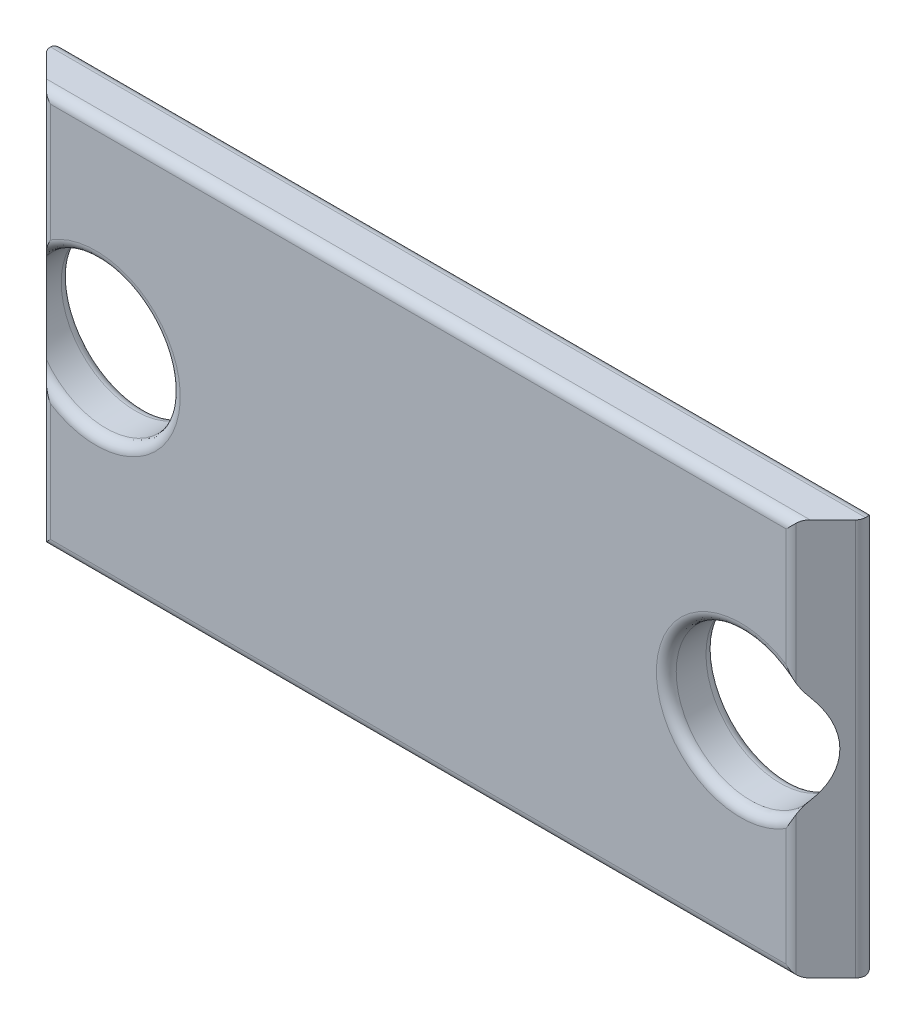
from build123d import *

# Parameters (mm, degrees)
ESQUISSE1_W        = 17
ESQUISSE1_H        = 8
ESQUISSE1_R        = 1.5
BOSS_EXTRU_1_DEPTH = 1
CHANFREIN1_SIZE    = 1
CONG_1_R           = 0.2


with BuildPart() as part:
    # Esquisse1 → Boss.-Extru.1 (new body)
    with BuildSketch(Plane.XY):
        with Locations((8.5, 4)):
            Rectangle(ESQUISSE1_W, ESQUISSE1_H)
        with Locations((2, 4)):
            Circle(ESQUISSE1_R, mode=Mode.SUBTRACT)
        with Locations((15, 4)):
            Circle(ESQUISSE1_R, mode=Mode.SUBTRACT)
    extrude(amount=BOSS_EXTRU_1_DEPTH)

    # Chanfrein1
    # the kernel refuses this chamfer: 1 mm, written as the material it takes off along each edge
    with BuildSketch(Plane(origin=(17, -2.571682988, 1), x_dir=(0.02749587661058563, 0, -0.9996219169112968), z_dir=(0, 1, 0)), Plane(origin=(0, 10.571682988, 1), x_dir=(-0.027495876610586372, 0, -0.9996219169112968), z_dir=(0, -1, 0))) as chanfrein1_piece_1:
        Polygon((CHANFREIN1_SIZE * 0.999621916911, CHANFREIN1_SIZE * 0.0274958766106), (-CHANFREIN1_SIZE * 0.0274958766106, CHANFREIN1_SIZE * 0.999621916911), (0, 0), align=None)
    extrude(amount=13.143365976, mode=Mode.SUBTRACT)

    # Congé1
    # the kernel refuses this fillet: 0.2 mm, written as the material it takes off along each edge
    with BuildSketch(Plane(origin=(15, 4, 0), x_dir=(1, 0, 0), z_dir=(0, -1, 0))) as cong_1_piece_1:
        with BuildLine():
            CenterArc((1.5 + CONG_1_R, CONG_1_R), CONG_1_R, 180, 90)
            Line((1.5, CONG_1_R), (1.5, 0))
            Line((1.5, 0), (1.5 + CONG_1_R, 0))
        make_face()
    revolve(axis=Axis((15, 4, 0), (0, 0, 1)), mode=Mode.SUBTRACT)
    with BuildSketch(Plane(origin=(-0.5, 0, 0), x_dir=(0, 0, 1), z_dir=(1, 0, 0))) as cong_1_piece_2:
        with BuildLine():
            CenterArc((CONG_1_R, -CONG_1_R), CONG_1_R, 90, 90)
            Line((0, -CONG_1_R), (0, 0))
            Line((0, 0), (CONG_1_R, 0))
        make_face()
    extrude(amount=18, mode=Mode.SUBTRACT)
    with BuildSketch(Plane(origin=(17, -1.207106781, 0), x_dir=(-1, 0, 0), z_dir=(0, 1, 0)), Plane(origin=(0, 9.207106781, 0), x_dir=(1, 0, 0), z_dir=(0, -1, 0))) as cong_1_piece_3:
        with BuildLine():
            CenterArc((CONG_1_R * 2.41421356237, CONG_1_R), CONG_1_R, 135, 135)
            Line((CONG_1_R * 1.70710678119, CONG_1_R * 1.70710678119), (0, 0))
            Line((0, 0), (CONG_1_R * 2.41421356237, 0))
        make_face()
    extrude(amount=10.414213562, mode=Mode.SUBTRACT)
    with BuildSketch(Plane(origin=(17.5, 8, 0), x_dir=(0, -1, 0), z_dir=(-1, 0, 0))) as cong_1_piece_4:
        with BuildLine():
            CenterArc((CONG_1_R, CONG_1_R), CONG_1_R, 180, 90)
            Line((0, CONG_1_R), (0, 0))
            Line((0, 0), (CONG_1_R, 0))
        make_face()
    extrude(amount=18, mode=Mode.SUBTRACT)
    with BuildSketch(Plane(origin=(2, 4, 0), x_dir=(1, 0, 0), z_dir=(0, -1, 0))) as cong_1_piece_5:
        with BuildLine():
            CenterArc((1.5 + CONG_1_R, CONG_1_R), CONG_1_R, 180, 90)
            Line((1.5, CONG_1_R), (1.5, 0))
            Line((1.5, 0), (1.5 + CONG_1_R, 0))
        make_face()
    revolve(axis=Axis((2, 4, 0), (0, 0, 1)), mode=Mode.SUBTRACT)
    with BuildSketch(Plane(origin=(1, 3.089072792, 1), x_dir=(1, 0, 0), z_dir=(0, -1, 0)), Plane(origin=(1, 8.207106781, 1), x_dir=(1, 0, 0), z_dir=(0, -1, 0))) as cong_1_piece_6:
        with BuildLine():
            CenterArc((CONG_1_R * 0.414213562373, -CONG_1_R), CONG_1_R, 90, 45)
            Line((-CONG_1_R * 0.292893218813, -CONG_1_R * 0.292893218813), (0, 0))
            Line((0, 0), (CONG_1_R * 0.414213562373, 0))
        make_face()
    extrude(amount=3.296179574, mode=Mode.SUBTRACT)
    with BuildSketch(Plane(origin=(2, 4, 1), x_dir=(-0.8739874769428458, -0.4859484439187749, 0), z_dir=(-0.4859484439187749, 0.8739874769428458, 0))) as cong_1_piece_7:
        with BuildLine():
            CenterArc((1.5 + CONG_1_R, -CONG_1_R), CONG_1_R, 90, 90)
            Line((1.5, -CONG_1_R), (1.5, 0))
            Line((1.5, 0), (1.5 + CONG_1_R, 0))
        make_face()
    revolve(axis=Axis((2, 4, 1), (0, 0, 1)), revolution_arc=150.925369424, mode=Mode.SUBTRACT)
    with BuildSketch(Plane(origin=(16.5, 8, 1), x_dir=(0, -1, 0), z_dir=(-1, 0, 0))) as cong_1_piece_8:
        with BuildLine():
            CenterArc((CONG_1_R, -CONG_1_R), CONG_1_R, 90, 90)
            Line((0, -CONG_1_R), (0, 0))
            Line((0, 0), (CONG_1_R, 0))
        make_face()
    extrude(amount=16, mode=Mode.SUBTRACT)
    with BuildSketch(Plane(origin=(16, 4.910927208, 1), x_dir=(0.707106781186839, 0, -0.707106781186256), z_dir=(0, 1, 0)), Plane(origin=(16, -0.207106781, 1), x_dir=(0.707106781186839, 0, -0.707106781186256), z_dir=(0, 1, 0))) as cong_1_piece_9:
        with BuildLine():
            CenterArc((CONG_1_R * 0.414213562373, CONG_1_R), CONG_1_R, 225, 45)
            Line((-CONG_1_R * 0.292893218813, CONG_1_R * 0.292893218813), (0, 0))
            Line((0, 0), (CONG_1_R * 0.414213562373, 0))
        make_face()
    extrude(amount=3.296179574, mode=Mode.SUBTRACT)
    with BuildSketch(Plane(origin=(15, 4, 1), x_dir=(0.8744070091205912, 0.48519313927629093, 0), z_dir=(0.48519313927629093, -0.8744070091205912, 0))) as cong_1_piece_10:
        with BuildLine():
            CenterArc((1.5 + CONG_1_R, -CONG_1_R), CONG_1_R, 90, 90)
            Line((1.5, -CONG_1_R), (1.5, 0))
            Line((1.5, 0), (1.5 + CONG_1_R, 0))
        make_face()
    revolve(axis=Axis((15, 4, 1), (0, 0, 1)), revolution_arc=301.949745716, mode=Mode.SUBTRACT)
    with BuildSketch(Plane(origin=(0.5, 0, 1), x_dir=(0, 0, -1), z_dir=(1, 0, 0))) as cong_1_piece_11:
        with BuildLine():
            CenterArc((CONG_1_R, CONG_1_R), CONG_1_R, 180, 90)
            Line((0, CONG_1_R), (0, 0))
            Line((0, 0), (CONG_1_R, 0))
        make_face()
    extrude(amount=16, mode=Mode.SUBTRACT)
    with BuildSketch(Plane(origin=(2, 4, 1), x_dir=(1, 0, 0), z_dir=(0, -1, 0))) as cong_1_piece_12:
        with BuildLine():
            CenterArc((1.5 + CONG_1_R, -CONG_1_R), CONG_1_R, 90, 90)
            Line((1.5, -CONG_1_R), (1.5, 0))
            Line((1.5, 0), (1.5 + CONG_1_R, 0))
        make_face()
    revolve(axis=Axis((2, 4, 1), (0, 0, 1)), revolution_arc=150.925369424, mode=Mode.SUBTRACT)


solid = part.part
